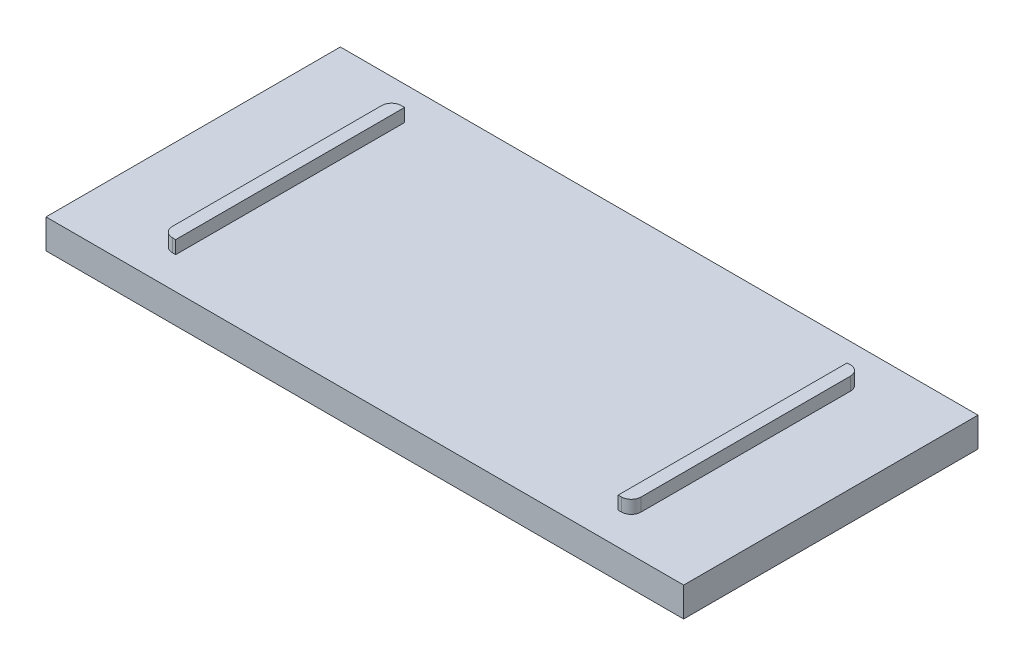
from build123d import *

# Parameters (mm, degrees)
ESQUISSE1_W                 = 160
ESQUISSE1_H                 = 90
T_LE_DE_BASE_PLI_E1_DEPTH   = 9
T_LE_PLI_E_SUR_AR_TE1_DEPTH = 90
T_LE_PLI_E_SUR_AR_TE2_DEPTH = 90
EXTRUSION1_DEPTH            = 4
ETAT_START                  = -116.640587823
ETAT_D_PLI_1_OUTLINE_W      = 10
ETAT_D_PLI_1_OUTLINE_H      = 90
ETAT_D_PLI_1_DEPTH          = 179.4732
ETAT_START_2                = -124.393019868
ETAT_D_PLI_1_2_OUTLINE_W    = 9
ETAT_D_PLI_1_2_OUTLINE_H    = 90
ETAT_D_PLI_1_2_DEPTH        = 194.978064089
ECHELLE1_SCALE              = 1.07


# Read off the part's stored shape, not the designer's step: Etat déplié1
# Sheet-metal steps are written as plain solids
with BuildPart() as part:
    # Esquisse1 → Tôle de base pliée1 (new body)
    with BuildSketch(Plane(origin=(0, 0, 0), x_dir=(1, 0, 0), z_dir=(0, 1, 0))):
        with Locations((-26.903987823, 16.826605784)):
            Rectangle(ESQUISSE1_W, ESQUISSE1_H)
    extrude(amount=T_LE_DE_BASE_PLI_E1_DEPTH)

    # Tôle pliée sur arête1 section (across the edge) → Tôle pliée sur arête1 (add)
    with BuildSketch(Plane(origin=(53.832612177, 0, -61.826605784), x_dir=(-1, 0, 0), z_dir=(0, 0, 1))):
        with BuildLine():
            Line((-9, 0.7366), (-9, 10))
            Line((-9, 10), (0, 10))
            Line((0, 10), (0, 0.7366))
            ThreePointArc((0, 0.7366), (0.215745145, 0.215745145), (0.7366, 0))
            Line((0.7366, 0), (0.7366, -9))
            ThreePointArc((0.7366, -9), (-6.148215886, -6.148215886), (-9, 0.7366))
        make_face()
    extrude(amount=T_LE_PLI_E_SUR_AR_TE1_DEPTH)

    # Tôle pliée sur arête2 section (across the edge) → Tôle pliée sur arête2 (add)
    with BuildSketch(Plane(origin=(-107.640587823, 0, 28.173394216), x_dir=(1, 0, 0), z_dir=(0, 0, -1))):
        with BuildLine():
            Line((-9, 0.7366), (-9, 10))
            Line((-9, 10), (0, 10))
            Line((0, 10), (0, 0.7366))
            ThreePointArc((0, 0.7366), (0.215745145, 0.215745145), (0.7366, 0))
            Line((0.7366, 0), (0.7366, -9))
            ThreePointArc((0.7366, -9), (-6.148215886, -6.148215886), (-9, 0.7366))
        make_face()
    extrude(amount=T_LE_PLI_E_SUR_AR_TE2_DEPTH)

    # Esquisse9 → Extrusion1 (add)
    with BuildSketch(Plane(origin=(0, 9, 0), x_dir=(1, 0, 0), z_dir=(0, 1, 0))):
        with BuildLine():
            Line((-95.557213934, 51.644704016), (-94.557213934, 51.644704016))
            Line((-94.557213934, 51.644704016), (-94.557213934, -18.355295984))
            Line((-94.557213934, -18.355295984), (-95.557213934, -18.355295984))
            ThreePointArc((-95.557213934, -18.355295984), (-97.678534277, -17.476616327), (-98.557213934, -15.355295984))
            Line((-98.557213934, -15.355295984), (-98.557213934, 48.644704016))
            ThreePointArc((-98.557213934, 48.644704016), (-97.678534277, 50.76602436), (-95.557213934, 51.644704016))
        make_face()
        with BuildLine():
            Line((40.749238287, 51.644704016), (40.749238287, -18.355295984))
            Line((40.749238287, -18.355295984), (41.749238287, -18.355295984))
            ThreePointArc((41.749238287, -18.355295984), (43.870558631, -17.476616327), (44.749238287, -15.355295984))
            Line((44.749238287, -15.355295984), (44.749238287, 48.644704016))
            ThreePointArc((44.749238287, 48.644704016), (43.870558631, 50.76602436), (41.749238287, 51.644704016))
            Line((41.749238287, 51.644704016), (40.749238287, 51.644704016))
        make_face()
    extrude(amount=EXTRUSION1_DEPTH)

    # Etat déplié1 outline → Etat déplié1 (cut)
    with BuildSketch(Plane.YZ.offset(ETAT_START)):
        with Locations((-5, -16.826605784)):
            Rectangle(ETAT_D_PLI_1_OUTLINE_W, ETAT_D_PLI_1_OUTLINE_H)
    extrude(amount=ETAT_D_PLI_1_DEPTH, mode=Mode.SUBTRACT)

    # Etat d_pli_1 2 outline → Etat d_pli_1 2 (add)
    with BuildSketch(Plane.YZ.offset(ETAT_START_2)):
        with Locations((4.5, -16.826605784)):
            Rectangle(ETAT_D_PLI_1_2_OUTLINE_W, ETAT_D_PLI_1_2_OUTLINE_H)
    extrude(amount=ETAT_D_PLI_1_2_DEPTH)


with BuildPart() as part_1:
    # Echelle1: scaled about (-26.903987823, 4.589665377, -16.824096508)
    add(part.part.scale(ECHELLE1_SCALE).moved(Location((1.883279148, -0.321276576, 1.177686756))))


solid = part_1.part
